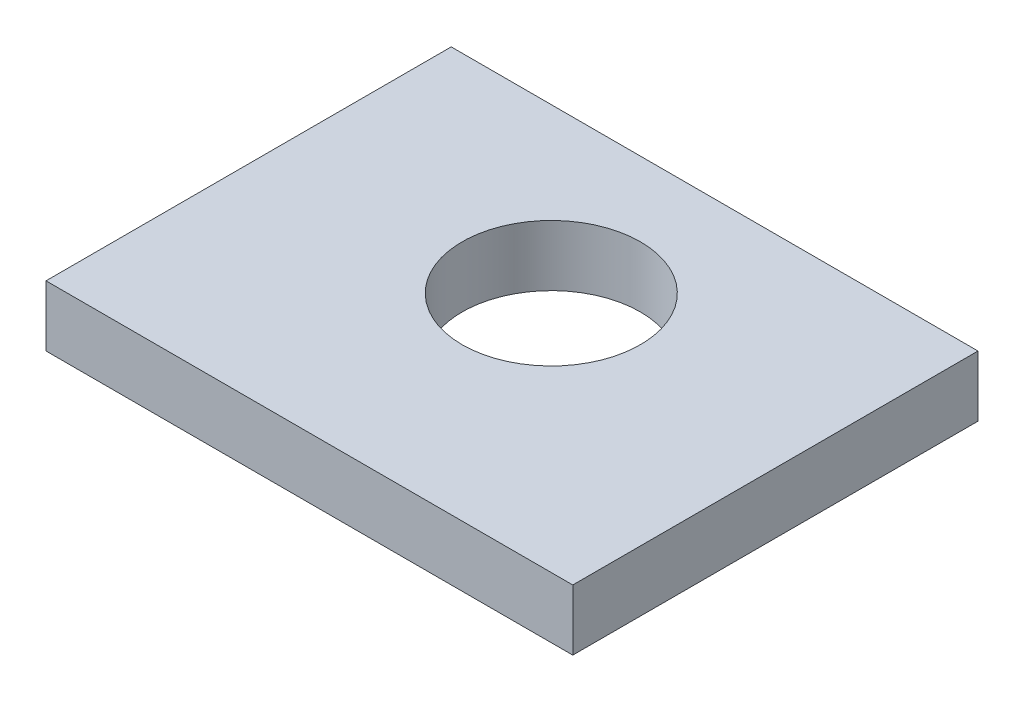
from build123d import *

# Parameters (mm, degrees)
SKETCH1_W           = 6.5
SKETCH1_H           = 5
BOSS_EXTRUDE1_DEPTH = 0.75
SKETCH2_R           = 1.1
CUT_EXTRUDE1_DEPTH  = 5.168333


with BuildPart() as part:
    # Sketch1 → Boss-Extrude1 (new body)
    with BuildSketch(Plane(origin=(0, 0, 0), x_dir=(1, 0, 0), z_dir=(0, 1, 0))):
        Rectangle(SKETCH1_W, SKETCH1_H)
    extrude(amount=BOSS_EXTRUDE1_DEPTH)

    # Sketch2 → Cut-Extrude1 (cut, through all)
    with BuildSketch(Plane(origin=(0, 0, 0), x_dir=(1, 0, 0), z_dir=(0, 1, 0))):
        with Locations((0, 0.484711092)):
            Circle(SKETCH2_R)
    extrude(amount=CUT_EXTRUDE1_DEPTH, mode=Mode.SUBTRACT)


solid = part.part
